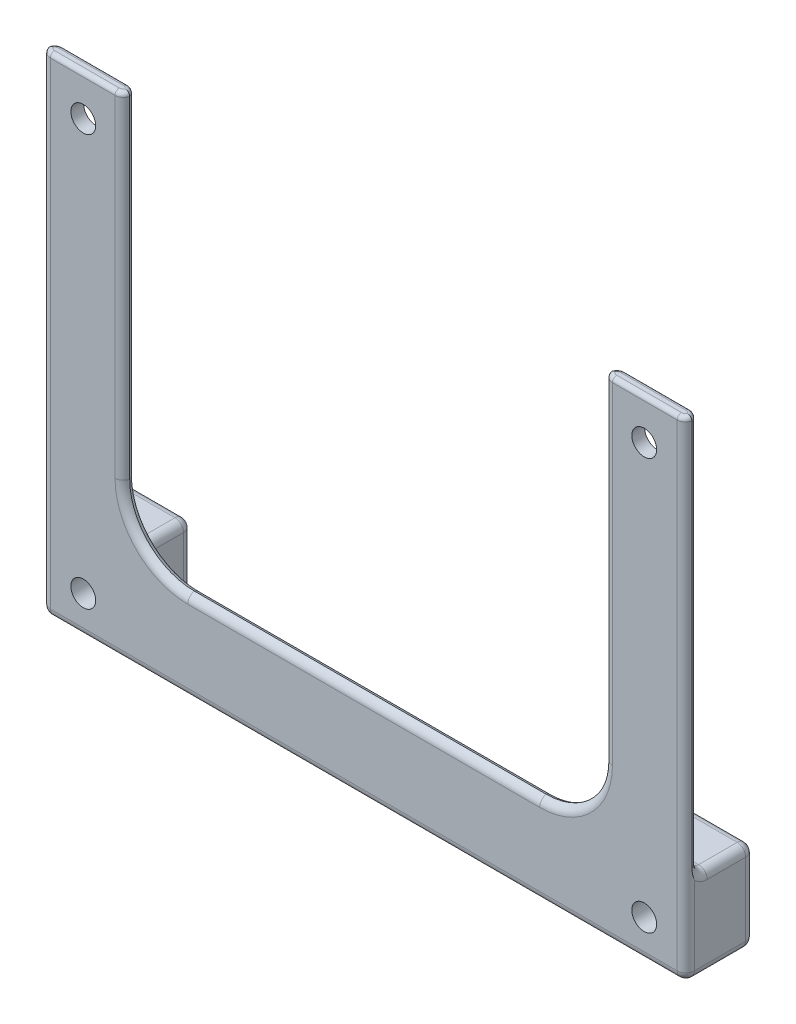
from build123d import *

# Parameters (mm, degrees)
ESQUISSE1_W        = 19.121320343
ESQUISSE1_H        = 114.414213562
ESQUISSE1_R        = 2.9
ESQUISSE1_W_2      = 112.171572876
ESQUISSE1_H_2      = 21
BOSS_EXTRU_1_DEPTH = 3
BOSS_EXTRU_2_START = 13
ESQUISSE2_W        = 19.121320343
ESQUISSE2_H        = 21
ESQUISSE2_R        = 2.9
BOSS_EXTRU_2_DEPTH = 13
CONG_1_R           = 15
CONG_2_R           = 2
CONG_3_R           = 1


# Some blends are built 0.0001 mm under size
with BuildPart() as part:
    # Esquisse1 → Boss.-Extru.1 (new body)
    # profile 1 of 3: a face of its own
    with BuildSketch(Plane.XY):
        with Locations((9.853553391, 38.207106781)):
            Rectangle(ESQUISSE1_W, ESQUISSE1_H)
        with Locations((10, 86)):
            Circle(ESQUISSE1_R, mode=Mode.SUBTRACT)
        with Locations((10, -10)):
            Circle(ESQUISSE1_R, mode=Mode.SUBTRACT)
    # profile 2 of 3: a face of its own
    with BuildSketch(Plane.XY):
        with Locations((75.5, -8.5)):
            Rectangle(ESQUISSE1_W_2, ESQUISSE1_H_2)
    # profile 3 of 3: a face of its own
    with BuildSketch(Plane.XY):
        with Locations((141.14644661, 38.207106781)):
            Rectangle(ESQUISSE1_W, ESQUISSE1_H)
        with Locations((141, 86)):
            Circle(ESQUISSE1_R, mode=Mode.SUBTRACT)
        with Locations((141, -10)):
            Circle(ESQUISSE1_R, mode=Mode.SUBTRACT)
    extrude(amount=BOSS_EXTRU_1_DEPTH)

    # Esquisse2 → Boss.-Extru.2 (add)
    # profile 1 of 2: a face of its own
    with BuildSketch(Plane(origin=(0, 0, 0), x_dir=(-1, 0, 0), z_dir=(0, 0, -1)).offset(BOSS_EXTRU_2_START)):
        with Locations((-141.14644661, -8.5)):
            Rectangle(ESQUISSE2_W, ESQUISSE2_H)
        with Locations(Location((-141, -10, 0), (0, 0, 180))):
            Circle(ESQUISSE2_R, mode=Mode.SUBTRACT)
    # profile 2 of 2: a face of its own
    with BuildSketch(Plane(origin=(0, 0, 0), x_dir=(-1, 0, 0), z_dir=(0, 0, -1)).offset(BOSS_EXTRU_2_START)):
        with Locations((-9.853553391, -8.5)):
            Rectangle(ESQUISSE2_W, ESQUISSE2_H)
        with Locations(Location((-10, -10, 0), (0, 0, 180))):
            Circle(ESQUISSE2_R, mode=Mode.SUBTRACT)
    extrude(amount=-BOSS_EXTRU_2_DEPTH)

    # Congé1
    # the kernel refuses this fillet: 15 mm, written as the material it adds along each edge
    with BuildSketch(Plane(origin=(19.414213562, 2, 0), x_dir=(0, 1, 0), z_dir=(0, 0, 1)), Plane(origin=(131.585786438, 2, 0), x_dir=(-1, 0, 0), z_dir=(0, 0, 1))) as cong_1_piece_1:
        with BuildLine():
            CenterArc((CONG_1_R, -CONG_1_R), CONG_1_R, 90, 90)
            Line((0, -CONG_1_R), (0, 0))
            Line((0, 0), (CONG_1_R, 0))
        make_face()
    extrude(amount=3)

    # Congé2
    # the kernel refuses this fillet: 2 mm, written as the material it takes off along each edge
    with BuildSketch(Plane(origin=(17.414213562, 0, -11), x_dir=(0, 0, -1), z_dir=(1, 0, 0))) as cong_2_piece_1_section:
        Polygon((0, 0), (CONG_2_R, 0), (CONG_2_R, CONG_2_R), (0, CONG_2_R), align=None)
    cong_2_piece_1 = extrude(amount=CONG_2_R, mode=Mode.PRIVATE)
    cong_2_piece_1 = cong_2_piece_1 - Plane(origin=(17.414213562, 0, -11), x_dir=(0, -0.7071067811865475, 0.7071067811865475), z_dir=(1, 0, 0)) * Sphere(CONG_2_R, mode=Mode.PRIVATE)
    add(cong_2_piece_1, mode=Mode.SUBTRACT)
    with BuildSketch(Plane(origin=(133.585786438, 0, -11), x_dir=(0, 0, -1), z_dir=(-1, 0, 0))) as cong_2_piece_2_section:
        Polygon((0, 0), (CONG_2_R, 0), (CONG_2_R, -CONG_2_R), (0, -CONG_2_R), align=None)
    cong_2_piece_2 = extrude(amount=CONG_2_R, mode=Mode.PRIVATE)
    cong_2_piece_2 = cong_2_piece_2 - Plane(origin=(133.585786438, 0, -11), x_dir=(0, -0.7071067811865475, 0.7071067811865475), z_dir=(-1, 0, 0)) * Sphere(CONG_2_R, mode=Mode.PRIVATE)
    add(cong_2_piece_2, mode=Mode.SUBTRACT)
    with BuildSketch(Plane(origin=(2.292893219, -17, -11), x_dir=(0, -1, 0), z_dir=(-1, 0, 0))) as cong_2_piece_3_section:
        Polygon((0, 0), (CONG_2_R, 0), (CONG_2_R, -CONG_2_R), (0, -CONG_2_R), align=None)
    cong_2_piece_3 = extrude(amount=CONG_2_R, mode=Mode.PRIVATE)
    cong_2_piece_3 = cong_2_piece_3 - Plane(origin=(2.292893219, -17, -11), x_dir=(0, 0.7071067811865475, 0.7071067811865475), z_dir=(-1, 0, 0)) * Sphere(CONG_2_R, mode=Mode.PRIVATE)
    add(cong_2_piece_3, mode=Mode.SUBTRACT)
    with BuildSketch(Plane(origin=(2.292893219, -17, 1), x_dir=(0, -1, 0), z_dir=(-1, 0, 0))) as cong_2_piece_4_section:
        Polygon((0, 0), (CONG_2_R, 0), (CONG_2_R, CONG_2_R), (0, CONG_2_R), align=None)
    cong_2_piece_4 = extrude(amount=CONG_2_R, mode=Mode.PRIVATE)
    cong_2_piece_4 = cong_2_piece_4 - Plane(origin=(2.292893219, -17, 1), x_dir=(0, 0.7071067811865475, -0.7071067811865475), z_dir=(-1, 0, 0)) * Sphere(CONG_2_R, mode=Mode.PRIVATE)
    add(cong_2_piece_4, mode=Mode.SUBTRACT)
    with BuildSketch(Plane(origin=(148.707106781, -17, -11), x_dir=(1, 0, 0), z_dir=(0, -1, 0))) as cong_2_piece_5_section:
        Polygon((0, 0), (CONG_2_R, 0), (CONG_2_R, -CONG_2_R), (0, -CONG_2_R), align=None)
    cong_2_piece_5 = extrude(amount=CONG_2_R, mode=Mode.PRIVATE)
    cong_2_piece_5 = cong_2_piece_5 - Plane(origin=(148.707106781, -17, -11), x_dir=(-0.7071067811865475, 0, 0.7071067811865475), z_dir=(0, -1, 0)) * Sphere(CONG_2_R, mode=Mode.PRIVATE)
    add(cong_2_piece_5, mode=Mode.SUBTRACT)
    with BuildSketch(Plane(origin=(148.707106781, -17, 1), x_dir=(1, 0, 0), z_dir=(0, -1, 0))) as cong_2_piece_6_section:
        Polygon((0, 0), (CONG_2_R, 0), (CONG_2_R, CONG_2_R), (0, CONG_2_R), align=None)
    cong_2_piece_6 = extrude(amount=CONG_2_R, mode=Mode.PRIVATE)
    cong_2_piece_6 = cong_2_piece_6 - Plane(origin=(148.707106781, -17, 1), x_dir=(-0.7071067811865475, 0, -0.7071067811865475), z_dir=(0, -1, 0)) * Sphere(CONG_2_R, mode=Mode.PRIVATE)
    add(cong_2_piece_6, mode=Mode.SUBTRACT)
    with BuildSketch(Plane(origin=(17.414213562, 2, -13), x_dir=(0, 0, 1), z_dir=(-1, 0, 0)), Plane(origin=(2.292893219, -19, -13), x_dir=(0, 0, 1), z_dir=(1, 0, 0)), Plane(origin=(126.585786438, -19, -13), x_dir=(0, 0, 1), z_dir=(1, 0, 0))) as cong_2_piece_7:
        with BuildLine():
            CenterArc((CONG_2_R, -CONG_2_R), CONG_2_R, 90, 90)
            Line((0, -CONG_2_R), (0, 0))
            Line((0, 0), (CONG_2_R, 0))
        make_face()
    extrude(amount=22.121320344, mode=Mode.SUBTRACT)
    with BuildSketch(Plane(origin=(155.707106781, 2, -13), x_dir=(0, -1, 0), z_dir=(-1, 0, 0))) as cong_2_piece_8:
        with BuildLine():
            CenterArc((CONG_2_R, CONG_2_R), CONG_2_R, 180, 90)
            Line((0, CONG_2_R), (0, 0))
            Line((0, 0), (CONG_2_R, 0))
        make_face()
    extrude(amount=22.121320344, mode=Mode.SUBTRACT)
    with BuildSketch(Plane(origin=(19.414213562, 17, 3), x_dir=(0, 0, -1), z_dir=(0, 1, 0)), Plane(origin=(131.585786438, 17, 3), x_dir=(1, 0, 0), z_dir=(0, 1, 0))) as cong_2_piece_9:
        with BuildLine():
            CenterArc((CONG_2_R, CONG_2_R), CONG_2_R, 180, 90)
            Line((0, CONG_2_R), (0, 0))
            Line((0, 0), (CONG_2_R, 0))
        make_face()
    extrude(amount=83.414213562, mode=Mode.SUBTRACT)
    with BuildSketch(Plane(origin=(19.414213562, 17, 0), x_dir=(0, 0, 1), z_dir=(0, 1, 0)), Plane(origin=(131.585786438, 17, 0), x_dir=(1, 0, 0), z_dir=(0, 1, 0))) as cong_2_piece_10:
        with BuildLine():
            CenterArc((CONG_2_R, -CONG_2_R), CONG_2_R, 90, 90)
            Line((0, -CONG_2_R), (0, 0))
            Line((0, 0), (CONG_2_R, 0))
        make_face()
    extrude(amount=83.414213562, mode=Mode.SUBTRACT)
    with BuildSketch(Plane(origin=(34.414213562, 17, 3), x_dir=(-1, 0, 0), z_dir=(0, 1, 0))) as cong_2_piece_11:
        with BuildLine():
            CenterArc((15 + CONG_2_R, -CONG_2_R), CONG_2_R, 90, 90)
            Line((15 + CONG_2_R, 0), (15, 0))
            Line((15, 0), (15, -CONG_2_R))
        make_face()
    revolve(axis=Axis((34.414213562, 17, 3), (0, 0, 1)), revolution_arc=90, mode=Mode.SUBTRACT)
    with BuildSketch(Plane(origin=(34.414213562, 17, 0), x_dir=(-1, 0, 0), z_dir=(0, 1, 0))) as cong_2_piece_12:
        with BuildLine():
            CenterArc((15 + CONG_2_R, CONG_2_R), CONG_2_R, 180, 90)
            Line((15 + CONG_2_R, 0), (15, 0))
            Line((15, 0), (15, CONG_2_R))
        make_face()
    revolve(axis=Axis((34.414213562, 17, 0), (0, 0, 1)), revolution_arc=90, mode=Mode.SUBTRACT)
    with BuildSketch(Plane(origin=(116.585786438, 2, 3), x_dir=(0, 0, -1), z_dir=(-1, 0, 0))) as cong_2_piece_13:
        with BuildLine():
            CenterArc((CONG_2_R, CONG_2_R), CONG_2_R, 180, 90)
            Line((0, CONG_2_R), (0, 0))
            Line((0, 0), (CONG_2_R, 0))
        make_face()
    extrude(amount=82.171572875, mode=Mode.SUBTRACT)
    with BuildSketch(Plane(origin=(116.585786438, 2, 0), x_dir=(0, 0, 1), z_dir=(-1, 0, 0))) as cong_2_piece_14:
        with BuildLine():
            CenterArc((CONG_2_R, -CONG_2_R), CONG_2_R, 90, 90)
            Line((0, -CONG_2_R), (0, 0))
            Line((0, 0), (CONG_2_R, 0))
        make_face()
    extrude(amount=82.171572875, mode=Mode.SUBTRACT)
    with BuildSketch(Plane(origin=(0.292893219, -19, -11), x_dir=(0, 1, 0), z_dir=(0, 0, 1)), Plane(origin=(150.707106781, -19, -11), x_dir=(-1, 0, 0), z_dir=(0, 0, 1))) as cong_2_piece_15:
        with BuildLine():
            CenterArc((CONG_2_R, -CONG_2_R), CONG_2_R, 90, 90)
            Line((0, -CONG_2_R), (0, 0))
            Line((0, 0), (CONG_2_R, 0))
        make_face()
    extrude(amount=12, mode=Mode.SUBTRACT)
    with BuildSketch(Plane(origin=(19.414213562, -24, -13), x_dir=(0, 0, 1), z_dir=(0, 1, 0)), Plane(origin=(150.707106781, -17, -13), x_dir=(0, 0, 1), z_dir=(0, 1, 0)), Plane(origin=(131.585786438, 0, -13), x_dir=(0, 0, 1), z_dir=(0, -1, 0)), Plane(origin=(0.292893219, 7, -13), x_dir=(0, 0, 1), z_dir=(0, -1, 0))) as cong_2_piece_16:
        with BuildLine():
            CenterArc((CONG_2_R, -CONG_2_R), CONG_2_R, 90, 90)
            Line((0, -CONG_2_R), (0, 0))
            Line((0, 0), (CONG_2_R, 0))
        make_face()
    extrude(amount=24, mode=Mode.SUBTRACT)
    with BuildSketch(Plane(origin=(19.414213562, 2, -11), x_dir=(-1, 0, 0), z_dir=(0, 0, 1)), Plane(origin=(131.585786438, 2, -11), x_dir=(0, -1, 0), z_dir=(0, 0, 1))) as cong_2_piece_17:
        with BuildLine():
            CenterArc((CONG_2_R, CONG_2_R), CONG_2_R, 180, 90)
            Line((0, CONG_2_R), (0, 0))
            Line((0, 0), (CONG_2_R, 0))
        make_face()
    extrude(amount=11, mode=Mode.SUBTRACT)
    with BuildSketch(Plane(origin=(0.292893219, 100.414213562, 3), x_dir=(1, 0, 0), z_dir=(0, -1, 0))) as cong_2_piece_18:
        with BuildLine():
            CenterArc((CONG_2_R, -CONG_2_R), CONG_2_R, 90, 90)
            Line((0, -CONG_2_R), (0, 0))
            Line((0, 0), (CONG_2_R, 0))
        make_face()
    extrude(amount=117.414213562, mode=Mode.SUBTRACT)
    with BuildSketch(Plane(origin=(148.707106781, -19, 3), x_dir=(0, 1, 0), z_dir=(-1, 0, 0))) as cong_2_piece_19:
        with BuildLine():
            CenterArc((CONG_2_R, CONG_2_R), CONG_2_R, 180, 90)
            Line((0, CONG_2_R), (0, 0))
            Line((0, 0), (CONG_2_R, 0))
        make_face()
    extrude(amount=146.414213562, mode=Mode.SUBTRACT)
    with BuildSketch(Plane(origin=(116.585786438, 17, 3), x_dir=(0, -1, 0), z_dir=(-1, 0, 0))) as cong_2_piece_20:
        with BuildLine():
            CenterArc((15 + CONG_2_R, -CONG_2_R), CONG_2_R, 90, 90)
            Line((15, -CONG_2_R), (15, 0))
            Line((15, 0), (15 + CONG_2_R, 0))
        make_face()
    revolve(axis=Axis((116.585786438, 17, 3), (0, 0, 1)), revolution_arc=90, mode=Mode.SUBTRACT)
    with BuildSketch(Plane(origin=(116.585786438, 17, 0), x_dir=(0, -1, 0), z_dir=(-1, 0, 0))) as cong_2_piece_21:
        with BuildLine():
            CenterArc((15 + CONG_2_R, CONG_2_R), CONG_2_R, 180, 90)
            Line((15, CONG_2_R), (15, 0))
            Line((15, 0), (15 + CONG_2_R, 0))
        make_face()
    revolve(axis=Axis((116.585786438, 17, 0), (0, 0, 1)), revolution_arc=90, mode=Mode.SUBTRACT)
    with BuildSketch(Plane(origin=(150.707106781, 100.414213562, 3), x_dir=(-1, 0, 0), z_dir=(0, -1, 0))) as cong_2_piece_22:
        with BuildLine():
            CenterArc((CONG_2_R, CONG_2_R), CONG_2_R, 180, 90)
            Line((0, CONG_2_R), (0, 0))
            Line((0, 0), (CONG_2_R, 0))
        make_face()
    extrude(amount=117.414213562, mode=Mode.SUBTRACT)
    # the kernel refuses this fillet: 2 mm, written as the material it adds along each edge
    with BuildSketch(Plane(origin=(17.414213562, 2, 0), x_dir=(0, 1, 0), z_dir=(-1, 0, 0)), Plane(origin=(150.707106781, 2, 0), x_dir=(0, 1, 0), z_dir=(-1, 0, 0))) as cong_2_2_piece_1:
        with BuildLine():
            CenterArc((CONG_2_R, CONG_2_R), CONG_2_R, 180, 90)
            Line((0, CONG_2_R), (0, 0))
            Line((0, 0), (CONG_2_R, 0))
        make_face()
    extrude(amount=17.121320344)
    with BuildSketch(Plane(origin=(19.414213562, -19, 0), x_dir=(1, 0, 0), z_dir=(0, 1, 0)), Plane(origin=(131.585786438, 0, 0), x_dir=(-1, 0, 0), z_dir=(0, -1, 0))) as cong_2_2_piece_2:
        with BuildLine():
            CenterArc((CONG_2_R, CONG_2_R), CONG_2_R, 180, 90)
            Line((0, CONG_2_R), (0, 0))
            Line((0, 0), (CONG_2_R, 0))
        make_face()
    extrude(amount=19)
    with BuildSketch(Plane(origin=(133.585786438, 0, 0), x_dir=(-1, 0, 0), z_dir=(0, -1, 0))) as cong_2_2_piece_3:
        with BuildLine():
            CenterArc((2 + CONG_2_R, CONG_2_R), CONG_2_R, 180, 90)
            Line((2, CONG_2_R), (2, 0))
            Line((2, 0), (2 + CONG_2_R, 0))
        make_face()
    revolve(axis=Axis((133.585786438, 0, 0), (0, 0, -1)), revolution_arc=90)
    with BuildSketch(Plane(origin=(17.414213562, 0, 0), x_dir=(0, 1, 0), z_dir=(-1, 0, 0))) as cong_2_2_piece_4:
        with BuildLine():
            CenterArc((2 + CONG_2_R, CONG_2_R), CONG_2_R, 180, 90)
            Line((2, CONG_2_R), (2, 0))
            Line((2, 0), (2 + CONG_2_R, 0))
        make_face()
    revolve(axis=Axis((17.414213562, 0, 0), (0, 0, -1)), revolution_arc=90)
    # the kernel refuses this fillet: 2 mm, written as the material it takes off along each edge
    with BuildSketch(Plane(origin=(133.585786438, -17, -11), x_dir=(-1, 0, 0), z_dir=(0, -1, 0))) as cong_2_3_piece_1_section:
        Polygon((0, 0), (CONG_2_R, 0), (CONG_2_R, CONG_2_R), (0, CONG_2_R), align=None)
    cong_2_3_piece_1 = extrude(amount=CONG_2_R, mode=Mode.PRIVATE)
    cong_2_3_piece_1 = cong_2_3_piece_1 - Plane(origin=(133.585786438, -17, -11), x_dir=(0.7071067811865475, 0, 0.7071067811865475), z_dir=(0, -1, 0)) * Sphere(CONG_2_R, mode=Mode.PRIVATE)
    add(cong_2_3_piece_1, mode=Mode.SUBTRACT)
    with BuildSketch(Plane(origin=(17.414213562, -17, -11), x_dir=(1, 0, 0), z_dir=(0, -1, 0))) as cong_2_3_piece_2_section:
        Polygon((0, 0), (CONG_2_R, 0), (CONG_2_R, -CONG_2_R), (0, -CONG_2_R), align=None)
    cong_2_3_piece_2 = extrude(amount=CONG_2_R, mode=Mode.PRIVATE)
    cong_2_3_piece_2 = cong_2_3_piece_2 - Plane(origin=(17.414213562, -17, -11), x_dir=(-0.7071067811865475, 0, 0.7071067811865475), z_dir=(0, -1, 0)) * Sphere(CONG_2_R, mode=Mode.PRIVATE)
    add(cong_2_3_piece_2, mode=Mode.SUBTRACT)
    with BuildSketch(Plane(origin=(2.292893219, 0, -11), x_dir=(0, 1, 0), z_dir=(-1, 0, 0))) as cong_2_3_piece_3_section:
        Polygon((0, 0), (CONG_2_R, 0), (CONG_2_R, CONG_2_R), (0, CONG_2_R), align=None)
    cong_2_3_piece_3 = extrude(amount=CONG_2_R, mode=Mode.PRIVATE)
    cong_2_3_piece_3 = cong_2_3_piece_3 - Plane(origin=(2.292893219, 0, -11), x_dir=(0, -0.7071067811865475, 0.7071067811865475), z_dir=(-1, 0, 0)) * Sphere(CONG_2_R, mode=Mode.PRIVATE)
    add(cong_2_3_piece_3, mode=Mode.SUBTRACT)
    with BuildSketch(Plane(origin=(148.707106781, 0, -11), x_dir=(0, 1, 0), z_dir=(1, 0, 0))) as cong_2_3_piece_4_section:
        Polygon((0, 0), (CONG_2_R, 0), (CONG_2_R, -CONG_2_R), (0, -CONG_2_R), align=None)
    cong_2_3_piece_4 = extrude(amount=CONG_2_R, mode=Mode.PRIVATE)
    cong_2_3_piece_4 = cong_2_3_piece_4 - Plane(origin=(148.707106781, 0, -11), x_dir=(0, -0.7071067811865475, 0.7071067811865475), z_dir=(1, 0, 0)) * Sphere(CONG_2_R, mode=Mode.PRIVATE)
    add(cong_2_3_piece_4, mode=Mode.SUBTRACT)
    with BuildSketch(Plane(origin=(0.292893219, 100.414213562, 0), x_dir=(1, 0, 0), z_dir=(0, -1, 0))) as cong_2_3_piece_5:
        with BuildLine():
            CenterArc((CONG_2_R, CONG_2_R), CONG_2_R, 180, 90)
            Line((0, CONG_2_R), (0, 0))
            Line((0, 0), (CONG_2_R, 0))
        make_face()
    extrude(amount=96.414213562, mode=Mode.SUBTRACT)
    with BuildSketch(Plane(origin=(150.707106781, 100.414213562, 0), x_dir=(-1, 0, 0), z_dir=(0, -1, 0))) as cong_2_3_piece_6:
        with BuildLine():
            CenterArc((CONG_2_R, -CONG_2_R), CONG_2_R, 90, 90)
            Line((0, -CONG_2_R), (0, 0))
            Line((0, 0), (CONG_2_R, 0))
        make_face()
    extrude(amount=96.414213562, mode=Mode.SUBTRACT)
    with BuildSketch(Plane(origin=(21.414213562, -19, 0), x_dir=(0, 1, 0), z_dir=(1, 0, 0))) as cong_2_3_piece_7:
        with BuildLine():
            CenterArc((CONG_2_R, CONG_2_R), CONG_2_R, 180, 90)
            Line((0, CONG_2_R), (0, 0))
            Line((0, 0), (CONG_2_R, 0))
        make_face()
    extrude(amount=108.171572875, mode=Mode.SUBTRACT)
    with BuildSketch(Plane(origin=(150.707106781, 2, -11), x_dir=(0, -1, 0), z_dir=(0, 0, 1)), Plane(origin=(19.414213562, -19, -11), x_dir=(-1, 0, 0), z_dir=(0, 0, 1))) as cong_2_3_piece_8:
        with BuildLine():
            CenterArc((CONG_2_R, -CONG_2_R), CONG_2_R, 90, 90)
            Line((0, -CONG_2_R), (0, 0))
            Line((0, 0), (CONG_2_R, 0))
        make_face()
    extrude(amount=9, mode=Mode.SUBTRACT)
    with BuildSketch(Plane(origin=(0.292893219, 2, -11), x_dir=(0, -1, 0), z_dir=(0, 0, 1)), Plane(origin=(131.585786438, -19, -11), x_dir=(1, 0, 0), z_dir=(0, 0, 1))) as cong_2_3_piece_9:
        with BuildLine():
            CenterArc((CONG_2_R, CONG_2_R), CONG_2_R, 180, 90)
            Line((0, CONG_2_R), (0, 0))
            Line((0, 0), (CONG_2_R, 0))
        make_face()
    extrude(amount=9, mode=Mode.SUBTRACT)
    with BuildSketch(Plane(origin=(129.585786438, -19, -2), x_dir=(0, 0, 1), z_dir=(-1, 0, 0))) as cong_2_3_piece_10:
        with BuildLine():
            CenterArc((2 + CONG_2_R, CONG_2_R), CONG_2_R, 180, 90)
            Line((2, CONG_2_R), (2, 0))
            Line((2, 0), (2 + CONG_2_R, 0))
        make_face()
    revolve(axis=Axis((129.585786438, -19, -2), (0, 1, 0)), revolution_arc=90, mode=Mode.SUBTRACT)
    with BuildSketch(Plane(origin=(21.414213562, -19, -2), x_dir=(0, 0, 1), z_dir=(1, 0, 0))) as cong_2_3_piece_11:
        with BuildLine():
            CenterArc((2 + CONG_2_R, -CONG_2_R), CONG_2_R, 90, 90)
            Line((2 + CONG_2_R, 0), (2, 0))
            Line((2, 0), (2, -CONG_2_R))
        make_face()
    revolve(axis=Axis((21.414213562, -19, -2), (0, -1, 0)), revolution_arc=90, mode=Mode.SUBTRACT)
    with BuildSketch(Plane(origin=(0.292893219, 4, -2), x_dir=(0, 0, 1), z_dir=(0, 1, 0))) as cong_2_3_piece_12:
        with BuildLine():
            CenterArc((2 + CONG_2_R, CONG_2_R), CONG_2_R, 180, 90)
            Line((2, CONG_2_R), (2, 0))
            Line((2, 0), (2 + CONG_2_R, 0))
        make_face()
    revolve(axis=Axis((0.292893219, 4, -2), (1, 0, 0)), revolution_arc=90, mode=Mode.SUBTRACT)
    with BuildSketch(Plane(origin=(150.707106781, 4, -2), x_dir=(0, 0, 1), z_dir=(0, 1, 0))) as cong_2_3_piece_13:
        with BuildLine():
            CenterArc((2 + CONG_2_R, -CONG_2_R), CONG_2_R, 90, 90)
            Line((2 + CONG_2_R, 0), (2, 0))
            Line((2, 0), (2, -CONG_2_R))
        make_face()
    revolve(axis=Axis((150.707106781, 4, -2), (1, 0, 0)), revolution_arc=90, mode=Mode.SUBTRACT)

    # Congé3
    cong_3_edges = [part.edges().sort_by_distance(p)[0] for p in [
        (9.853553391, 95.414213562, 3),
        (1.068148347, 95.414213562, 2.58113883),
        (1.068148347, 95.414213562, 0.41886117),
        (18.638958434, 95.414213562, 2.58113883),
        (18.638958434, 95.414213562, 0.41886117),
        (141.146446609, 95.414213562, 3),
        (149.931851653, 95.414213562, 2.58113883),
        (149.931851653, 95.414213562, 0.41886117),
        (132.361041566, 95.414213562, 2.58113883),
        (132.361041566, 95.414213562, 0.41886117),
        (9.853553391, 95.414213562, 0),
        (141.146446609, 95.414213562, 0),
    ]]
    fillet(cong_3_edges, radius=CONG_3_R - 0.0001)  # a hair under: the kernel refuses the full size


solid = part.part
